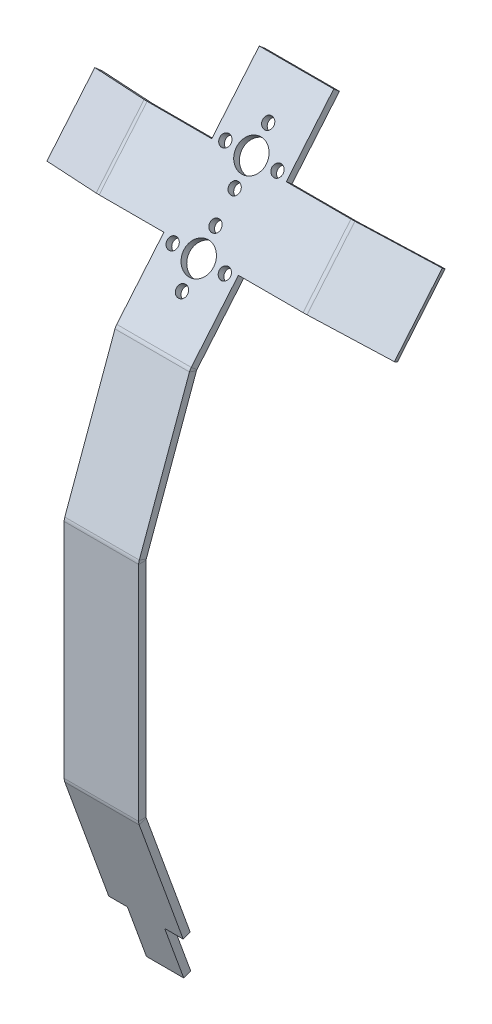
from build123d import *

# Parameters (mm, degrees)
SKETCH1_W                      = 20
SKETCH1_H                      = 60
BASE_FLANGE1_DEPTH             = 2
EDGE_FLANGE1_STRIP_CUT_DEPTH   = 20
EDGE_FLANGE1_DEPTH             = 20
EDGE_FLANGE2_STRIP_CUT_DEPTH   = 20
EDGE_FLANGE2_DEPTH             = 20
EDGE_FLANGE3_STRIP_CUT_DEPTH   = 20
EDGE_FLANGE3_DEPTH             = 20
EDGE_FLANGE3_START             = 2
EDGE_FLANGE3_FLAT_DEPTH        = 2
EDGE_FLANGE4_STRIP_CUT_DEPTH   = 20
EDGE_FLANGE4_STRIP_CUT_2_DEPTH = 20
EDGE_FLANGE4_DEPTH             = 20
EDGE_FLANGE4_BEND_DEPTH        = 20
SKETCH16_W                     = 5
SKETCH16_H                     = 15
CUT_EXTRUDE2_DEPTH             = 142.77897769
SKETCH23_R                     = 4
SKETCH23_R_2                   = 1.5
CUT_EXTRUDE3_DEPTH             = 2


# Sheet-metal steps are written as plain solids
with BuildPart() as part:
    # Sketch1 → Base-Flange1 (new body)
    with BuildSketch(Plane.XY):
        Rectangle(SKETCH1_W, SKETCH1_H)
    extrude(amount=-BASE_FLANGE1_DEPTH)

    # Edge-Flange1 strip (across the edge) → Edge-Flange1 strip cut (cut)
    with BuildSketch(Plane(origin=(-10, 30, -2), x_dir=(0, -0.3420201433256631, -0.9396926207859105), z_dir=(1, 0, 0))):
        Polygon((-5.074988048, 8.095806265), (-1.834962826, -0.80608987), (0.044422416, -0.122049584), (-3.195602806, 8.779846552), align=None)
    extrude(amount=EDGE_FLANGE1_STRIP_CUT_DEPTH, mode=Mode.SUBTRACT)

    # Edge-Flange1 section (across the edge) → Edge-Flange1 (add)
    with BuildSketch(Plane(origin=(-10, 30, -2), x_dir=(0, -0.3420201433256631, -0.9396926207859105), z_dir=(1, 0, 0))):
        with BuildLine():
            Line((-2, 0.129882454), (-2, 39.647346039))
            Line((-2, 39.647346039), (0, 39.647346039))
            Line((0, 39.647346039), (0, 0.129882454))
            ThreePointArc((0, 0.129882454), (0.011190609, 0.001973206), (0.044422416, -0.122049584))
            Line((0.044422416, -0.122049584), (-1.834962826, -0.80608987))
            ThreePointArc((-1.834962826, -0.80608987), (-1.958424897, -0.345323149), (-2, 0.129882454))
        make_face()
    extrude(amount=EDGE_FLANGE1_DEPTH)

    # Edge-Flange2 strip (across the edge) → Edge-Flange2 strip cut (cut)
    with BuildSketch(Plane(origin=(10, -30, -2), x_dir=(0, 0.34202014332566344, -0.9396926207859103), z_dir=(-1, 0, 0))):
        Polygon((-5.074988048, 8.095806265), (-1.834962826, -0.80608987), (0.044422416, -0.122049584), (-3.195602806, 8.779846552), align=None)
    extrude(amount=EDGE_FLANGE2_STRIP_CUT_DEPTH, mode=Mode.SUBTRACT)

    # Edge-Flange2 section (across the edge) → Edge-Flange2 (add)
    with BuildSketch(Plane(origin=(10, -30, -2), x_dir=(0, 0.34202014332566344, -0.9396926207859103), z_dir=(-1, 0, 0))):
        with BuildLine():
            Line((-2, 0.129882454), (-2, 49.647346039))
            Line((-2, 49.647346039), (0, 49.647346039))
            Line((0, 49.647346039), (0, 0.129882454))
            ThreePointArc((0, 0.129882454), (0.011190609, 0.001973206), (0.044422416, -0.122049584))
            Line((0.044422416, -0.122049584), (-1.834962826, -0.80608987))
            ThreePointArc((-1.834962826, -0.80608987), (-1.958424897, -0.345323149), (-2, 0.129882454))
        make_face()
    extrude(amount=EDGE_FLANGE2_DEPTH)

    # Edge-Flange3 strip (across the edge) → Edge-Flange3 strip cut (cut)
    with BuildSketch(Plane(origin=(-10, 67.256318506, -15.560190975), x_dir=(0, -0.6427876096865303, -0.7660444431189858), z_dir=(1, 0, 0))):
        Polygon((-5.074988048, 8.095806265), (-1.834962826, -0.80608987), (0.044422416, -0.122049584), (-3.195602806, 8.779846552), align=None)
    extrude(amount=EDGE_FLANGE3_STRIP_CUT_DEPTH, mode=Mode.SUBTRACT)

    # Edge-Flange3 bend section (across the edge) → Edge-Flange3 (add)
    with BuildSketch(Plane(origin=(-10, 67.256318506, -15.560190975), x_dir=(0, -0.6427876096865303, -0.7660444431189858), z_dir=(1, 0, 0))):
        with BuildLine():
            Line((-2, 0.129882454), (0, 0.129882454))
            ThreePointArc((0, 0.129882454), (0.011190609, 0.001973206), (0.044422416, -0.122049584))
            Line((0.044422416, -0.122049584), (-1.834962826, -0.80608987))
            ThreePointArc((-1.834962826, -0.80608987), (-1.958424897, -0.345323149), (-2, 0.129882454))
        make_face()
    extrude(amount=EDGE_FLANGE3_DEPTH)

    # Edge-Flange3 profile (on flange) → Edge-Flange3 flat (add)
    with BuildSketch(Plane(origin=(0, 67.256318506, -15.560190975), x_dir=(1, 0, 0), z_dir=(0, 0.6427876096865303, 0.7660444431189858)).offset(EDGE_FLANGE3_START)):
        Polygon((10, 0.129882454), (10, 19.823673019), (27.5, 19.823673019), (27.5, 39.823673019), (10, 39.823673019), (10, 59.647346039), (-10, 59.647346039), (-10, 39.823673019), (-27.5, 39.823673019), (-27.5, 19.823673019), (-10, 19.823673019), (-10, 0.129882454), align=None)
    extrude(amount=-EDGE_FLANGE3_FLAT_DEPTH)

    # Edge-Flange4 strip (across the edge) → Edge-Flange4 strip cut (cut)
    with BuildSketch(Plane(origin=(27.5, 97.763021927, -41.158354564), x_dir=(-0.34202014332566383, -0.6040227735550463, -0.7198463103929629), z_dir=(0, -0.7660444431189858, 0.6427876096865304))):
        Polygon((-5.074988048, 8.095806265), (-1.834962826, -0.80608987), (0.044422416, -0.122049584), (-3.195602806, 8.779846552), align=None)
    extrude(amount=EDGE_FLANGE4_STRIP_CUT_DEPTH, mode=Mode.SUBTRACT)

    # Edge-Flange4 strip 2 (across the edge) → Edge-Flange4 strip cut 2 (cut)
    with BuildSketch(Plane(origin=(-27.5, 82.442133065, -28.30260237), x_dir=(0.3420201433256639, -0.6040227735550463, -0.7198463103929628), z_dir=(0, 0.7660444431189859, -0.6427876096865303))):
        Polygon((-5.074988048, 8.095806265), (-1.834962826, -0.80608987), (0.044422416, -0.122049584), (-3.195602806, 8.779846552), align=None)
    extrude(amount=EDGE_FLANGE4_STRIP_CUT_2_DEPTH, mode=Mode.SUBTRACT)

    # Edge-Flange4 section (across the edge) → Edge-Flange4 (add)
    with BuildSketch(Plane(origin=(27.5, 97.763021927, -41.158354564), x_dir=(-0.34202014332566383, -0.6040227735550463, -0.7198463103929629), z_dir=(0, -0.7660444431189858, 0.6427876096865304))):
        with BuildLine():
            Line((-2, 0.129882454), (-2, 19.647346039))
            Line((-2, 19.647346039), (0, 19.647346039))
            Line((0, 19.647346039), (0, 0.129882454))
            ThreePointArc((0, 0.129882454), (0.011190609, 0.001973206), (0.044422416, -0.122049584))
            Line((0.044422416, -0.122049584), (-1.834962826, -0.80608987))
            ThreePointArc((-1.834962826, -0.80608987), (-1.958424897, -0.345323149), (-2, 0.129882454))
        make_face()
    extrude(amount=EDGE_FLANGE4_DEPTH)

    # Edge-Flange4 section 2 (across the edge) → Edge-Flange4 bend (add)
    with BuildSketch(Plane(origin=(-27.5, 82.442133065, -28.30260237), x_dir=(0.3420201433256639, -0.6040227735550463, -0.7198463103929628), z_dir=(0, 0.7660444431189859, -0.6427876096865303))):
        with BuildLine():
            Line((-2, 0.129882454), (-2, 19.647346039))
            Line((-2, 19.647346039), (0, 19.647346039))
            Line((0, 19.647346039), (0, 0.129882454))
            ThreePointArc((0, 0.129882454), (0.011190609, 0.001973206), (0.044422416, -0.122049584))
            Line((0.044422416, -0.122049584), (-1.834962826, -0.80608987))
            ThreePointArc((-1.834962826, -0.80608987), (-1.958424897, -0.345323149), (-2, 0.129882454))
        make_face()
    extrude(amount=EDGE_FLANGE4_BEND_DEPTH)

    # Sketch16 → Cut-Extrude2 (cut, through all)
    with BuildSketch(Plane(origin=(0, -3.55058603, 9.755154944), x_dir=(1, 0, 0), z_dir=(0, -0.3420201433256634, 0.9396926207859103))):
        with Locations((-7.5, -71.022164949)):
            Rectangle(SKETCH16_W, SKETCH16_H)
        with Locations((7.5, -71.022164949)):
            Rectangle(SKETCH16_W, SKETCH16_H)
    extrude(amount=-CUT_EXTRUDE2_DEPTH, mode=Mode.SUBTRACT)

    # Sketch23 → Cut-Extrude3 (cut)
    with BuildSketch(Plane(origin=(0, 20.126792325, 23.986177061), x_dir=(-1, 0, 0), z_dir=(0, -0.6427876096865301, -0.7660444431189858))):
        with Locations(Location((0, 102.346900038, 0), (0, 0, 90))):
            Circle(SKETCH23_R)
        with Locations(Location((0, 109.346900038, 0), (0, 0, 90))):
            Circle(SKETCH23_R_2)
        with Locations(Location((7, 102.346900038, 0), (0, 0, 90))):
            Circle(SKETCH23_R_2)
        with Locations(Location((0, 95.346900038, 0), (0, 0, 90))):
            Circle(SKETCH23_R_2)
        with Locations(Location((-7, 102.346900038, 0), (0, 0, 90))):
            Circle(SKETCH23_R_2)
        with Locations(Location((-7, 80.346900038, 0), (0, 0, 270))):
            Circle(SKETCH23_R_2)
        with Locations(Location((7, 80.346900038, 0), (0, 0, 270))):
            Circle(SKETCH23_R_2)
        with Locations(Location((0, 80.346900038, 0), (0, 0, 270))):
            Circle(SKETCH23_R)
        with Locations(Location((0, 87.346900038, 0), (0, 0, 270))):
            Circle(SKETCH23_R_2)
        with Locations(Location((0, 73.346900038, 0), (0, 0, 270))):
            Circle(SKETCH23_R_2)
    extrude(amount=-CUT_EXTRUDE3_DEPTH, mode=Mode.SUBTRACT)


solid = part.part
